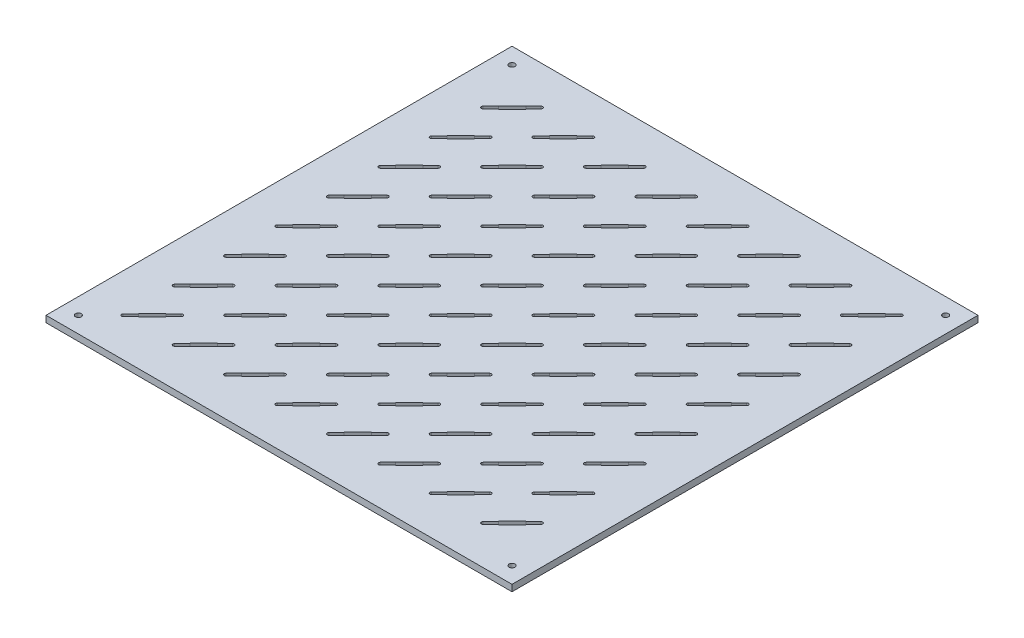
from build123d import *

# Parameters (mm, degrees)
SKETCH1_W           = 431.8
SKETCH1_H           = 431.8
BOSS_EXTRUDE1_DEPTH = 6
CUT_EXTRUDE1_DEPTH  = 4
SKETCH5_R           = 1.5875
CUT_EXTRUDE3_DEPTH  = 611.68689195
SKETCH6_R           = 2.65
CUT_EXTRUDE4_DEPTH  = 611.68689195


with BuildPart() as part:
    # Sketch1 → Boss-Extrude1 (new body)
    with BuildSketch(Plane(origin=(0, 0, 0), x_dir=(1, 0, 0), z_dir=(0, 1, 0))):
        with Locations((215.9, 215.9)):
            Rectangle(SKETCH1_W, SKETCH1_H)
    extrude(amount=BOSS_EXTRUDE1_DEPTH)

    # Sketch2 → Cut-Extrude1 (cut)
    with BuildSketch(Plane(origin=(0, 6, 0), x_dir=(1, 0, 0), z_dir=(0, 1, 0))):
        Polygon((41.725327811, 43.970391841), (34.654259999, 36.899324029), (36.899324029, 34.654259999), (43.970391841, 41.725327811), (44.262073388, 41.433646263), (56.98999545, 54.161568325), (56.698313902, 54.453249872), (63.769381714, 61.524317684), (61.524317684, 63.769381714), (54.453249872, 56.698313902), (54.161568325, 56.98999545), (41.433646263, 44.262073388), align=None)
        Polygon((56.98999545, 101.791568325), (56.698313902, 102.083249872), (63.769381714, 109.154317684), (61.524317684, 111.399381714), (54.453249872, 104.328313902), (54.161568325, 104.61999545), (41.433646263, 91.892073388), (41.725327811, 91.600391841), (34.654259999, 84.529324029), (36.899324029, 82.284259999), (43.970391841, 89.355327811), (44.262073388, 89.063646263), align=None)
        Polygon((56.98999545, 149.421568325), (56.698313902, 149.713249872), (63.769381714, 156.784317684), (61.524317684, 159.029381714), (54.453249872, 151.958313902), (54.161568325, 152.24999545), (41.433646263, 139.522073388), (41.725327811, 139.230391841), (34.654259999, 132.159324029), (36.899324029, 129.914259999), (43.970391841, 136.985327811), (44.262073388, 136.693646263), align=None)
        Polygon((56.98999545, 197.051568325), (56.698313902, 197.343249872), (63.769381714, 204.414317684), (61.524317684, 206.659381714), (54.453249872, 199.588313902), (54.161568325, 199.87999545), (41.433646263, 187.152073388), (41.725327811, 186.860391841), (34.654259999, 179.789324029), (36.899324029, 177.544259999), (43.970391841, 184.615327811), (44.262073388, 184.323646263), align=None)
        Polygon((56.98999545, 244.681568325), (56.698313902, 244.973249872), (63.769381714, 252.044317684), (61.524317684, 254.289381714), (54.453249872, 247.218313902), (54.161568325, 247.50999545), (41.433646263, 234.782073388), (41.725327811, 234.490391841), (34.654259999, 227.419324029), (36.899324029, 225.174259999), (43.970391841, 232.245327811), (44.262073388, 231.953646263), align=None)
        Polygon((56.98999545, 292.311568325), (56.698313902, 292.603249872), (63.769381714, 299.674317684), (61.524317684, 301.919381714), (54.453249872, 294.848313902), (54.161568325, 295.13999545), (41.433646263, 282.412073388), (41.725327811, 282.120391841), (34.654259999, 275.049324029), (36.899324029, 272.804259999), (43.970391841, 279.875327811), (44.262073388, 279.583646263), align=None)
        Polygon((56.98999545, 339.941568325), (56.698313902, 340.233249872), (63.769381714, 347.304317684), (61.524317684, 349.549381714), (54.453249872, 342.478313902), (54.161568325, 342.76999545), (41.433646263, 330.042073388), (41.725327811, 329.750391841), (34.654259999, 322.679324029), (36.899324029, 320.434259999), (43.970391841, 327.505327811), (44.262073388, 327.213646263), align=None)
        Polygon((56.98999545, 387.571568325), (56.698313902, 387.863249872), (63.769381714, 394.934317684), (61.524317684, 397.179381714), (54.453249872, 390.108313902), (54.161568325, 390.39999545), (41.433646263, 377.672073388), (41.725327811, 377.380391841), (34.654259999, 370.309324029), (36.899324029, 368.064259999), (43.970391841, 375.135327811), (44.262073388, 374.843646263), align=None)
        Polygon((104.619995449, 101.791568325), (104.328313902, 102.083249872), (111.399381714, 109.154317684), (109.154317684, 111.399381714), (102.083249872, 104.328313902), (101.791568325, 104.61999545), (89.063646263, 91.892073388), (89.355327811, 91.600391841), (82.284259999, 84.529324029), (84.529324029, 82.284259999), (91.600391841, 89.355327811), (91.892073388, 89.063646263), align=None)
        Polygon((104.619995449, 149.421568325), (104.328313902, 149.713249872), (111.399381714, 156.784317684), (109.154317684, 159.029381714), (102.083249872, 151.958313902), (101.791568325, 152.24999545), (89.063646263, 139.522073388), (89.355327811, 139.230391841), (82.284259999, 132.159324029), (84.529324029, 129.914259999), (91.600391841, 136.985327811), (91.892073388, 136.693646263), align=None)
        Polygon((104.619995449, 197.051568325), (104.328313902, 197.343249872), (111.399381714, 204.414317684), (109.154317684, 206.659381714), (102.083249872, 199.588313902), (101.791568325, 199.87999545), (89.063646263, 187.152073388), (89.355327811, 186.860391841), (82.284259999, 179.789324029), (84.529324029, 177.544259999), (91.600391841, 184.615327811), (91.892073388, 184.323646263), align=None)
        Polygon((104.619995449, 244.681568325), (104.328313902, 244.973249872), (111.399381714, 252.044317684), (109.154317684, 254.289381714), (102.083249872, 247.218313902), (101.791568325, 247.50999545), (89.063646263, 234.782073388), (89.355327811, 234.490391841), (82.284259999, 227.419324029), (84.529324029, 225.174259999), (91.600391841, 232.245327811), (91.892073388, 231.953646263), align=None)
        Polygon((104.619995449, 292.311568325), (104.328313902, 292.603249872), (111.399381714, 299.674317684), (109.154317684, 301.919381714), (102.083249872, 294.848313902), (101.791568325, 295.13999545), (89.063646263, 282.412073388), (89.355327811, 282.120391841), (82.284259999, 275.049324029), (84.529324029, 272.804259999), (91.600391841, 279.875327811), (91.892073388, 279.583646263), align=None)
        Polygon((104.619995449, 339.941568325), (104.328313902, 340.233249872), (111.399381714, 347.304317684), (109.154317684, 349.549381714), (102.083249872, 342.478313902), (101.791568325, 342.76999545), (89.063646263, 330.042073388), (89.355327811, 329.750391841), (82.284259999, 322.679324029), (84.529324029, 320.434259999), (91.600391841, 327.505327811), (91.892073388, 327.213646263), align=None)
        Polygon((104.619995449, 387.571568325), (104.328313902, 387.863249872), (111.399381714, 394.934317684), (109.154317684, 397.179381714), (102.083249872, 390.108313902), (101.791568325, 390.39999545), (89.063646263, 377.672073388), (89.355327811, 377.380391841), (82.284259999, 370.309324029), (84.529324029, 368.064259999), (91.600391841, 375.135327811), (91.892073388, 374.843646263), align=None)
        Polygon((152.249995449, 101.791568325), (151.958313902, 102.083249872), (159.029381714, 109.154317684), (156.784317684, 111.399381714), (149.713249872, 104.328313902), (149.421568325, 104.61999545), (136.693646263, 91.892073388), (136.985327811, 91.600391841), (129.914259999, 84.529324029), (132.159324029, 82.284259999), (139.230391841, 89.355327811), (139.522073388, 89.063646263), align=None)
        Polygon((152.249995449, 149.421568325), (151.958313902, 149.713249872), (159.029381714, 156.784317684), (156.784317684, 159.029381714), (149.713249872, 151.958313902), (149.421568325, 152.24999545), (136.693646263, 139.522073388), (136.985327811, 139.230391841), (129.914259999, 132.159324029), (132.159324029, 129.914259999), (139.230391841, 136.985327811), (139.522073388, 136.693646263), align=None)
        Polygon((152.249995449, 197.051568325), (151.958313902, 197.343249872), (159.029381714, 204.414317684), (156.784317684, 206.659381714), (149.713249872, 199.588313902), (149.421568325, 199.87999545), (136.693646263, 187.152073388), (136.985327811, 186.860391841), (129.914259999, 179.789324029), (132.159324029, 177.544259999), (139.230391841, 184.615327811), (139.522073388, 184.323646263), align=None)
        Polygon((152.249995449, 244.681568325), (151.958313902, 244.973249872), (159.029381714, 252.044317684), (156.784317684, 254.289381714), (149.713249872, 247.218313902), (149.421568325, 247.50999545), (136.693646263, 234.782073388), (136.985327811, 234.490391841), (129.914259999, 227.419324029), (132.159324029, 225.174259999), (139.230391841, 232.245327811), (139.522073388, 231.953646263), align=None)
        Polygon((152.249995449, 292.311568325), (151.958313902, 292.603249872), (159.029381714, 299.674317684), (156.784317684, 301.919381714), (149.713249872, 294.848313902), (149.421568325, 295.13999545), (136.693646263, 282.412073388), (136.985327811, 282.120391841), (129.914259999, 275.049324029), (132.159324029, 272.804259999), (139.230391841, 279.875327811), (139.522073388, 279.583646263), align=None)
        Polygon((152.249995449, 339.941568325), (151.958313902, 340.233249872), (159.029381714, 347.304317684), (156.784317684, 349.549381714), (149.713249872, 342.478313902), (149.421568325, 342.76999545), (136.693646263, 330.042073388), (136.985327811, 329.750391841), (129.914259999, 322.679324029), (132.159324029, 320.434259999), (139.230391841, 327.505327811), (139.522073388, 327.213646263), align=None)
        Polygon((152.249995449, 387.571568325), (151.958313902, 387.863249872), (159.029381714, 394.934317684), (156.784317684, 397.179381714), (149.713249872, 390.108313902), (149.421568325, 390.39999545), (136.693646263, 377.672073388), (136.985327811, 377.380391841), (129.914259999, 370.309324029), (132.159324029, 368.064259999), (139.230391841, 375.135327811), (139.522073388, 374.843646263), align=None)
        Polygon((199.879995449, 101.791568325), (199.588313902, 102.083249872), (206.659381714, 109.154317684), (204.414317684, 111.399381714), (197.343249872, 104.328313902), (197.051568325, 104.61999545), (184.323646263, 91.892073388), (184.615327811, 91.600391841), (177.544259999, 84.529324029), (179.789324029, 82.284259999), (186.860391841, 89.355327811), (187.152073388, 89.063646263), align=None)
        Polygon((199.879995449, 149.421568325), (199.588313902, 149.713249872), (206.659381714, 156.784317684), (204.414317684, 159.029381714), (197.343249872, 151.958313902), (197.051568325, 152.24999545), (184.323646263, 139.522073388), (184.615327811, 139.230391841), (177.544259999, 132.159324029), (179.789324029, 129.914259999), (186.860391841, 136.985327811), (187.152073388, 136.693646263), align=None)
        Polygon((199.879995449, 197.051568325), (199.588313902, 197.343249872), (206.659381714, 204.414317684), (204.414317684, 206.659381714), (197.343249872, 199.588313902), (197.051568325, 199.87999545), (184.323646263, 187.152073388), (184.615327811, 186.860391841), (177.544259999, 179.789324029), (179.789324029, 177.544259999), (186.860391841, 184.615327811), (187.152073388, 184.323646263), align=None)
        Polygon((199.879995449, 244.681568325), (199.588313902, 244.973249872), (206.659381714, 252.044317684), (204.414317684, 254.289381714), (197.343249872, 247.218313902), (197.051568325, 247.50999545), (184.323646263, 234.782073388), (184.615327811, 234.490391841), (177.544259999, 227.419324029), (179.789324029, 225.174259999), (186.860391841, 232.245327811), (187.152073388, 231.953646263), align=None)
        Polygon((199.879995449, 292.311568325), (199.588313902, 292.603249872), (206.659381714, 299.674317684), (204.414317684, 301.919381714), (197.343249872, 294.848313902), (197.051568325, 295.13999545), (184.323646263, 282.412073388), (184.615327811, 282.120391841), (177.544259999, 275.049324029), (179.789324029, 272.804259999), (186.860391841, 279.875327811), (187.152073388, 279.583646263), align=None)
        Polygon((199.879995449, 339.941568325), (199.588313902, 340.233249872), (206.659381714, 347.304317684), (204.414317684, 349.549381714), (197.343249872, 342.478313902), (197.051568325, 342.76999545), (184.323646263, 330.042073388), (184.615327811, 329.750391841), (177.544259999, 322.679324029), (179.789324029, 320.434259999), (186.860391841, 327.505327811), (187.152073388, 327.213646263), align=None)
        Polygon((199.879995449, 387.571568325), (199.588313902, 387.863249872), (206.659381714, 394.934317684), (204.414317684, 397.179381714), (197.343249872, 390.108313902), (197.051568325, 390.39999545), (184.323646263, 377.672073388), (184.615327811, 377.380391841), (177.544259999, 370.309324029), (179.789324029, 368.064259999), (186.860391841, 375.135327811), (187.152073388, 374.843646263), align=None)
        Polygon((247.509995449, 101.791568325), (247.218313902, 102.083249872), (254.289381714, 109.154317684), (252.044317684, 111.399381714), (244.973249872, 104.328313902), (244.681568325, 104.61999545), (231.953646263, 91.892073388), (232.245327811, 91.600391841), (225.174259999, 84.529324029), (227.419324029, 82.284259999), (234.490391841, 89.355327811), (234.782073388, 89.063646263), align=None)
        Polygon((247.509995449, 149.421568325), (247.218313902, 149.713249872), (254.289381714, 156.784317684), (252.044317684, 159.029381714), (244.973249872, 151.958313902), (244.681568325, 152.24999545), (231.953646263, 139.522073388), (232.245327811, 139.230391841), (225.174259999, 132.159324029), (227.419324029, 129.914259999), (234.490391841, 136.985327811), (234.782073388, 136.693646263), align=None)
        Polygon((247.509995449, 197.051568325), (247.218313902, 197.343249872), (254.289381714, 204.414317684), (252.044317684, 206.659381714), (244.973249872, 199.588313902), (244.681568325, 199.87999545), (231.953646263, 187.152073388), (232.245327811, 186.860391841), (225.174259999, 179.789324029), (227.419324029, 177.544259999), (234.490391841, 184.615327811), (234.782073388, 184.323646263), align=None)
        Polygon((247.509995449, 244.681568325), (247.218313902, 244.973249872), (254.289381714, 252.044317684), (252.044317684, 254.289381714), (244.973249872, 247.218313902), (244.681568325, 247.50999545), (231.953646263, 234.782073388), (232.245327811, 234.490391841), (225.174259999, 227.419324029), (227.419324029, 225.174259999), (234.490391841, 232.245327811), (234.782073388, 231.953646263), align=None)
        Polygon((247.509995449, 292.311568325), (247.218313902, 292.603249872), (254.289381714, 299.674317684), (252.044317684, 301.919381714), (244.973249872, 294.848313902), (244.681568325, 295.13999545), (231.953646263, 282.412073388), (232.245327811, 282.120391841), (225.174259999, 275.049324029), (227.419324029, 272.804259999), (234.490391841, 279.875327811), (234.782073388, 279.583646263), align=None)
        Polygon((247.509995449, 339.941568325), (247.218313902, 340.233249872), (254.289381714, 347.304317684), (252.044317684, 349.549381714), (244.973249872, 342.478313902), (244.681568325, 342.76999545), (231.953646263, 330.042073388), (232.245327811, 329.750391841), (225.174259999, 322.679324029), (227.419324029, 320.434259999), (234.490391841, 327.505327811), (234.782073388, 327.213646263), align=None)
        Polygon((247.509995449, 387.571568325), (247.218313902, 387.863249872), (254.289381714, 394.934317684), (252.044317684, 397.179381714), (244.973249872, 390.108313902), (244.681568325, 390.39999545), (231.953646263, 377.672073388), (232.245327811, 377.380391841), (225.174259999, 370.309324029), (227.419324029, 368.064259999), (234.490391841, 375.135327811), (234.782073388, 374.843646263), align=None)
        Polygon((295.139995449, 101.791568325), (294.848313902, 102.083249872), (301.919381714, 109.154317684), (299.674317684, 111.399381714), (292.603249872, 104.328313902), (292.311568325, 104.61999545), (279.583646263, 91.892073388), (279.875327811, 91.600391841), (272.804259999, 84.529324029), (275.049324029, 82.284259999), (282.120391841, 89.355327811), (282.412073388, 89.063646263), align=None)
        Polygon((295.139995449, 149.421568325), (294.848313902, 149.713249872), (301.919381714, 156.784317684), (299.674317684, 159.029381714), (292.603249872, 151.958313902), (292.311568325, 152.24999545), (279.583646263, 139.522073388), (279.875327811, 139.230391841), (272.804259999, 132.159324029), (275.049324029, 129.914259999), (282.120391841, 136.985327811), (282.412073388, 136.693646263), align=None)
        Polygon((295.139995449, 197.051568325), (294.848313902, 197.343249872), (301.919381714, 204.414317684), (299.674317684, 206.659381714), (292.603249872, 199.588313902), (292.311568325, 199.87999545), (279.583646263, 187.152073388), (279.875327811, 186.860391841), (272.804259999, 179.789324029), (275.049324029, 177.544259999), (282.120391841, 184.615327811), (282.412073388, 184.323646263), align=None)
        Polygon((295.139995449, 244.681568325), (294.848313902, 244.973249872), (301.919381714, 252.044317684), (299.674317684, 254.289381714), (292.603249872, 247.218313902), (292.311568325, 247.50999545), (279.583646263, 234.782073388), (279.875327811, 234.490391841), (272.804259999, 227.419324029), (275.049324029, 225.174259999), (282.120391841, 232.245327811), (282.412073388, 231.953646263), align=None)
        Polygon((295.139995449, 292.311568325), (294.848313902, 292.603249872), (301.919381714, 299.674317684), (299.674317684, 301.919381714), (292.603249872, 294.848313902), (292.311568325, 295.13999545), (279.583646263, 282.412073388), (279.875327811, 282.120391841), (272.804259999, 275.049324029), (275.049324029, 272.804259999), (282.120391841, 279.875327811), (282.412073388, 279.583646263), align=None)
        Polygon((295.139995449, 339.941568325), (294.848313902, 340.233249872), (301.919381714, 347.304317684), (299.674317684, 349.549381714), (292.603249872, 342.478313902), (292.311568325, 342.76999545), (279.583646263, 330.042073388), (279.875327811, 329.750391841), (272.804259999, 322.679324029), (275.049324029, 320.434259999), (282.120391841, 327.505327811), (282.412073388, 327.213646263), align=None)
        Polygon((295.139995449, 387.571568325), (294.848313902, 387.863249872), (301.919381714, 394.934317684), (299.674317684, 397.179381714), (292.603249872, 390.108313902), (292.311568325, 390.39999545), (279.583646263, 377.672073388), (279.875327811, 377.380391841), (272.804259999, 370.309324029), (275.049324029, 368.064259999), (282.120391841, 375.135327811), (282.412073388, 374.843646263), align=None)
        Polygon((342.769995449, 101.791568325), (342.478313902, 102.083249872), (349.549381714, 109.154317684), (347.304317684, 111.399381714), (340.233249872, 104.328313902), (339.941568325, 104.61999545), (327.213646263, 91.892073388), (327.505327811, 91.600391841), (320.434259999, 84.529324029), (322.679324029, 82.284259999), (329.750391841, 89.355327811), (330.042073388, 89.063646263), align=None)
        Polygon((342.769995449, 149.421568325), (342.478313902, 149.713249872), (349.549381714, 156.784317684), (347.304317684, 159.029381714), (340.233249872, 151.958313902), (339.941568325, 152.24999545), (327.213646263, 139.522073388), (327.505327811, 139.230391841), (320.434259999, 132.159324029), (322.679324029, 129.914259999), (329.750391841, 136.985327811), (330.042073388, 136.693646263), align=None)
        Polygon((342.769995449, 197.051568325), (342.478313902, 197.343249872), (349.549381714, 204.414317684), (347.304317684, 206.659381714), (340.233249872, 199.588313902), (339.941568325, 199.87999545), (327.213646263, 187.152073388), (327.505327811, 186.860391841), (320.434259999, 179.789324029), (322.679324029, 177.544259999), (329.750391841, 184.615327811), (330.042073388, 184.323646263), align=None)
        Polygon((342.769995449, 244.681568325), (342.478313902, 244.973249872), (349.549381714, 252.044317684), (347.304317684, 254.289381714), (340.233249872, 247.218313902), (339.941568325, 247.50999545), (327.213646263, 234.782073388), (327.505327811, 234.490391841), (320.434259999, 227.419324029), (322.679324029, 225.174259999), (329.750391841, 232.245327811), (330.042073388, 231.953646263), align=None)
        Polygon((342.769995449, 292.311568325), (342.478313902, 292.603249872), (349.549381714, 299.674317684), (347.304317684, 301.919381714), (340.233249872, 294.848313902), (339.941568325, 295.13999545), (327.213646263, 282.412073388), (327.505327811, 282.120391841), (320.434259999, 275.049324029), (322.679324029, 272.804259999), (329.750391841, 279.875327811), (330.042073388, 279.583646263), align=None)
        Polygon((342.769995449, 339.941568325), (342.478313902, 340.233249872), (349.549381714, 347.304317684), (347.304317684, 349.549381714), (340.233249872, 342.478313902), (339.941568325, 342.76999545), (327.213646263, 330.042073388), (327.505327811, 329.750391841), (320.434259999, 322.679324029), (322.679324029, 320.434259999), (329.750391841, 327.505327811), (330.042073388, 327.213646263), align=None)
        Polygon((342.769995449, 387.571568325), (342.478313902, 387.863249872), (349.549381714, 394.934317684), (347.304317684, 397.179381714), (340.233249872, 390.108313902), (339.941568325, 390.39999545), (327.213646263, 377.672073388), (327.505327811, 377.380391841), (320.434259999, 370.309324029), (322.679324029, 368.064259999), (329.750391841, 375.135327811), (330.042073388, 374.843646263), align=None)
        Polygon((390.399995449, 101.791568325), (390.108313902, 102.083249872), (397.179381714, 109.154317684), (394.934317684, 111.399381714), (387.863249872, 104.328313902), (387.571568325, 104.61999545), (374.843646263, 91.892073388), (375.13532781, 91.600391841), (368.064259999, 84.529324029), (370.309324029, 82.284259999), (377.380391841, 89.355327811), (377.672073388, 89.063646263), align=None)
        Polygon((390.399995449, 149.421568325), (390.108313902, 149.713249872), (397.179381714, 156.784317684), (394.934317684, 159.029381714), (387.863249872, 151.958313902), (387.571568325, 152.24999545), (374.843646263, 139.522073388), (375.13532781, 139.230391841), (368.064259999, 132.159324029), (370.309324029, 129.914259999), (377.380391841, 136.985327811), (377.672073388, 136.693646263), align=None)
        Polygon((390.399995449, 197.051568325), (390.108313902, 197.343249872), (397.179381714, 204.414317684), (394.934317684, 206.659381714), (387.863249872, 199.588313902), (387.571568325, 199.87999545), (374.843646263, 187.152073388), (375.13532781, 186.860391841), (368.064259999, 179.789324029), (370.309324029, 177.544259999), (377.380391841, 184.615327811), (377.672073388, 184.323646263), align=None)
        Polygon((390.399995449, 244.681568325), (390.108313902, 244.973249872), (397.179381714, 252.044317684), (394.934317684, 254.289381714), (387.863249872, 247.218313902), (387.571568325, 247.50999545), (374.843646263, 234.782073388), (375.13532781, 234.490391841), (368.064259999, 227.419324029), (370.309324029, 225.174259999), (377.380391841, 232.245327811), (377.672073388, 231.953646263), align=None)
        Polygon((390.399995449, 292.311568325), (390.108313902, 292.603249872), (397.179381714, 299.674317684), (394.934317684, 301.919381714), (387.863249872, 294.848313902), (387.571568325, 295.13999545), (374.843646263, 282.412073388), (375.13532781, 282.120391841), (368.064259999, 275.049324029), (370.309324029, 272.804259999), (377.380391841, 279.875327811), (377.672073388, 279.583646263), align=None)
        Polygon((390.399995449, 339.941568325), (390.108313902, 340.233249872), (397.179381714, 347.304317684), (394.934317684, 349.549381714), (387.863249872, 342.478313902), (387.571568325, 342.76999545), (374.843646263, 330.042073388), (375.13532781, 329.750391841), (368.064259999, 322.679324029), (370.309324029, 320.434259999), (377.380391841, 327.505327811), (377.672073388, 327.213646263), align=None)
        Polygon((390.399995449, 387.571568325), (390.108313902, 387.863249872), (397.179381714, 394.934317684), (394.934317684, 397.179381714), (387.863249872, 390.108313902), (387.571568325, 390.39999545), (374.843646263, 377.672073388), (375.13532781, 377.380391841), (368.064259999, 370.309324029), (370.309324029, 368.064259999), (377.380391841, 375.135327811), (377.672073388, 374.843646263), align=None)
        Polygon((104.619995449, 54.161568325), (104.328313902, 54.453249872), (111.399381714, 61.524317684), (109.154317684, 63.769381714), (102.083249872, 56.698313902), (101.791568325, 56.98999545), (89.063646263, 44.262073388), (89.355327811, 43.970391841), (82.284259999, 36.899324029), (84.529324029, 34.654259999), (91.600391841, 41.725327811), (91.892073388, 41.433646263), align=None)
        Polygon((152.249995449, 54.161568325), (151.958313902, 54.453249872), (159.029381714, 61.524317684), (156.784317684, 63.769381714), (149.713249872, 56.698313902), (149.421568325, 56.98999545), (136.693646263, 44.262073388), (136.985327811, 43.970391841), (129.914259999, 36.899324029), (132.159324029, 34.654259999), (139.230391841, 41.725327811), (139.522073388, 41.433646263), align=None)
        Polygon((199.879995449, 54.161568325), (199.588313902, 54.453249872), (206.659381714, 61.524317684), (204.414317684, 63.769381714), (197.343249872, 56.698313902), (197.051568325, 56.98999545), (184.323646263, 44.262073388), (184.615327811, 43.970391841), (177.544259999, 36.899324029), (179.789324029, 34.654259999), (186.860391841, 41.725327811), (187.152073388, 41.433646263), align=None)
        Polygon((247.509995449, 54.161568325), (247.218313902, 54.453249872), (254.289381714, 61.524317684), (252.044317684, 63.769381714), (244.973249872, 56.698313902), (244.681568325, 56.98999545), (231.953646263, 44.262073388), (232.245327811, 43.970391841), (225.174259999, 36.899324029), (227.419324029, 34.654259999), (234.490391841, 41.725327811), (234.782073388, 41.433646263), align=None)
        Polygon((295.139995449, 54.161568325), (294.848313902, 54.453249872), (301.919381714, 61.524317684), (299.674317684, 63.769381714), (292.603249872, 56.698313902), (292.311568325, 56.98999545), (279.583646263, 44.262073388), (279.875327811, 43.970391841), (272.804259999, 36.899324029), (275.049324029, 34.654259999), (282.120391841, 41.725327811), (282.412073388, 41.433646263), align=None)
        Polygon((342.769995449, 54.161568325), (342.478313902, 54.453249872), (349.549381714, 61.524317684), (347.304317684, 63.769381714), (340.233249872, 56.698313902), (339.941568325, 56.98999545), (327.213646263, 44.262073388), (327.505327811, 43.970391841), (320.434259999, 36.899324029), (322.679324029, 34.654259999), (329.750391841, 41.725327811), (330.042073388, 41.433646263), align=None)
        Polygon((390.399995449, 54.161568325), (390.108313902, 54.453249872), (397.179381714, 61.524317684), (394.934317684, 63.769381714), (387.863249872, 56.698313902), (387.571568325, 56.98999545), (374.843646263, 44.262073388), (375.13532781, 43.970391841), (368.064259999, 36.899324029), (370.309324029, 34.654259999), (377.380391841, 41.725327811), (377.672073388, 41.433646263), align=None)
    extrude(amount=-CUT_EXTRUDE1_DEPTH, mode=Mode.SUBTRACT)

    # Sketch5 → Cut-Extrude3 (cut, through all)
    with BuildSketch(Plane(origin=(0, 6, 0), x_dir=(1, 0, 0), z_dir=(0, 1, 0))):
        with Locations((35.776792014, 35.776792014)):
            Circle(SKETCH5_R)
        with Locations((62.646849699, 62.646849699)):
            Circle(SKETCH5_R)
        with Locations((35.776792014, 83.406792014)):
            Circle(SKETCH5_R)
        with Locations((62.646849699, 110.276849699)):
            Circle(SKETCH5_R)
        with Locations((35.776792014, 131.036792014)):
            Circle(SKETCH5_R)
        with Locations((62.646849699, 157.906849699)):
            Circle(SKETCH5_R)
        with Locations((35.776792014, 178.666792014)):
            Circle(SKETCH5_R)
        with Locations((62.646849699, 205.536849699)):
            Circle(SKETCH5_R)
        with Locations((35.776792014, 226.296792014)):
            Circle(SKETCH5_R)
        with Locations((62.646849699, 253.166849699)):
            Circle(SKETCH5_R)
        with Locations((35.776792014, 273.926792014)):
            Circle(SKETCH5_R)
        with Locations((62.646849699, 300.796849699)):
            Circle(SKETCH5_R)
        with Locations((35.776792014, 321.556792014)):
            Circle(SKETCH5_R)
        with Locations((62.646849699, 348.426849699)):
            Circle(SKETCH5_R)
        with Locations((35.776792014, 369.186792014)):
            Circle(SKETCH5_R)
        with Locations((62.646849699, 396.056849699)):
            Circle(SKETCH5_R)
        with Locations((83.406792014, 83.406792014)):
            Circle(SKETCH5_R)
        with Locations((110.276849699, 110.276849699)):
            Circle(SKETCH5_R)
        with Locations((83.406792014, 131.036792014)):
            Circle(SKETCH5_R)
        with Locations((110.276849699, 157.906849699)):
            Circle(SKETCH5_R)
        with Locations((83.406792014, 178.666792014)):
            Circle(SKETCH5_R)
        with Locations((110.276849699, 205.536849699)):
            Circle(SKETCH5_R)
        with Locations((83.406792014, 226.296792014)):
            Circle(SKETCH5_R)
        with Locations((110.276849699, 253.166849699)):
            Circle(SKETCH5_R)
        with Locations((83.406792014, 273.926792014)):
            Circle(SKETCH5_R)
        with Locations((110.276849699, 300.796849699)):
            Circle(SKETCH5_R)
        with Locations((83.406792014, 321.556792014)):
            Circle(SKETCH5_R)
        with Locations((110.276849699, 348.426849699)):
            Circle(SKETCH5_R)
        with Locations((83.406792014, 369.186792014)):
            Circle(SKETCH5_R)
        with Locations((110.276849699, 396.056849699)):
            Circle(SKETCH5_R)
        with Locations((131.036792014, 83.406792014)):
            Circle(SKETCH5_R)
        with Locations((157.906849699, 110.276849699)):
            Circle(SKETCH5_R)
        with Locations((131.036792014, 131.036792014)):
            Circle(SKETCH5_R)
        with Locations((157.906849699, 157.906849699)):
            Circle(SKETCH5_R)
        with Locations((131.036792014, 178.666792014)):
            Circle(SKETCH5_R)
        with Locations((157.906849699, 205.536849699)):
            Circle(SKETCH5_R)
        with Locations((131.036792014, 226.296792014)):
            Circle(SKETCH5_R)
        with Locations((157.906849699, 253.166849699)):
            Circle(SKETCH5_R)
        with Locations((131.036792014, 273.926792014)):
            Circle(SKETCH5_R)
        with Locations((157.906849699, 300.796849699)):
            Circle(SKETCH5_R)
        with Locations((131.036792014, 321.556792014)):
            Circle(SKETCH5_R)
        with Locations((157.906849699, 348.426849699)):
            Circle(SKETCH5_R)
        with Locations((131.036792014, 369.186792014)):
            Circle(SKETCH5_R)
        with Locations((157.906849699, 396.056849699)):
            Circle(SKETCH5_R)
        with Locations((178.666792014, 83.406792014)):
            Circle(SKETCH5_R)
        with Locations((205.536849699, 110.276849699)):
            Circle(SKETCH5_R)
        with Locations((178.666792014, 131.036792014)):
            Circle(SKETCH5_R)
        with Locations((205.536849699, 157.906849699)):
            Circle(SKETCH5_R)
        with Locations((178.666792014, 178.666792014)):
            Circle(SKETCH5_R)
        with Locations((205.536849699, 205.536849699)):
            Circle(SKETCH5_R)
        with Locations((178.666792014, 226.296792014)):
            Circle(SKETCH5_R)
        with Locations((205.536849699, 253.166849699)):
            Circle(SKETCH5_R)
        with Locations((178.666792014, 273.926792014)):
            Circle(SKETCH5_R)
        with Locations((205.536849699, 300.796849699)):
            Circle(SKETCH5_R)
        with Locations((178.666792014, 321.556792014)):
            Circle(SKETCH5_R)
        with Locations((205.536849699, 348.426849699)):
            Circle(SKETCH5_R)
        with Locations((178.666792014, 369.186792014)):
            Circle(SKETCH5_R)
        with Locations((205.536849699, 396.056849699)):
            Circle(SKETCH5_R)
        with Locations((226.296792014, 83.406792014)):
            Circle(SKETCH5_R)
        with Locations((253.166849699, 110.276849699)):
            Circle(SKETCH5_R)
        with Locations((226.296792014, 131.036792014)):
            Circle(SKETCH5_R)
        with Locations((253.166849699, 157.906849699)):
            Circle(SKETCH5_R)
        with Locations((226.296792014, 178.666792014)):
            Circle(SKETCH5_R)
        with Locations((253.166849699, 205.536849699)):
            Circle(SKETCH5_R)
        with Locations((226.296792014, 226.296792014)):
            Circle(SKETCH5_R)
        with Locations((253.166849699, 253.166849699)):
            Circle(SKETCH5_R)
        with Locations((226.296792014, 273.926792014)):
            Circle(SKETCH5_R)
        with Locations((253.166849699, 300.796849699)):
            Circle(SKETCH5_R)
        with Locations((226.296792014, 321.556792014)):
            Circle(SKETCH5_R)
        with Locations((253.166849699, 348.426849699)):
            Circle(SKETCH5_R)
        with Locations((226.296792014, 369.186792014)):
            Circle(SKETCH5_R)
        with Locations((253.166849699, 396.056849699)):
            Circle(SKETCH5_R)
        with Locations((273.926792014, 83.406792014)):
            Circle(SKETCH5_R)
        with Locations((300.796849699, 110.276849699)):
            Circle(SKETCH5_R)
        with Locations((273.926792014, 131.036792014)):
            Circle(SKETCH5_R)
        with Locations((300.796849699, 157.906849699)):
            Circle(SKETCH5_R)
        with Locations((273.926792014, 178.666792014)):
            Circle(SKETCH5_R)
        with Locations((300.796849699, 205.536849699)):
            Circle(SKETCH5_R)
        with Locations((273.926792014, 226.296792014)):
            Circle(SKETCH5_R)
        with Locations((300.796849699, 253.166849699)):
            Circle(SKETCH5_R)
        with Locations((273.926792014, 273.926792014)):
            Circle(SKETCH5_R)
        with Locations((300.796849699, 300.796849699)):
            Circle(SKETCH5_R)
        with Locations((273.926792014, 321.556792014)):
            Circle(SKETCH5_R)
        with Locations((300.796849699, 348.426849699)):
            Circle(SKETCH5_R)
        with Locations((273.926792014, 369.186792014)):
            Circle(SKETCH5_R)
        with Locations((300.796849699, 396.056849699)):
            Circle(SKETCH5_R)
        with Locations((321.556792014, 83.406792014)):
            Circle(SKETCH5_R)
        with Locations((348.426849699, 110.276849699)):
            Circle(SKETCH5_R)
        with Locations((321.556792014, 131.036792014)):
            Circle(SKETCH5_R)
        with Locations((348.426849699, 157.906849699)):
            Circle(SKETCH5_R)
        with Locations((321.556792014, 178.666792014)):
            Circle(SKETCH5_R)
        with Locations((348.426849699, 205.536849699)):
            Circle(SKETCH5_R)
        with Locations((321.556792014, 226.296792014)):
            Circle(SKETCH5_R)
        with Locations((348.426849699, 253.166849699)):
            Circle(SKETCH5_R)
        with Locations((321.556792014, 273.926792014)):
            Circle(SKETCH5_R)
        with Locations((348.426849699, 300.796849699)):
            Circle(SKETCH5_R)
        with Locations((321.556792014, 321.556792014)):
            Circle(SKETCH5_R)
        with Locations((348.426849699, 348.426849699)):
            Circle(SKETCH5_R)
        with Locations((321.556792014, 369.186792014)):
            Circle(SKETCH5_R)
        with Locations((348.426849699, 396.056849699)):
            Circle(SKETCH5_R)
        with Locations((369.186792014, 83.406792014)):
            Circle(SKETCH5_R)
        with Locations((396.056849699, 110.276849699)):
            Circle(SKETCH5_R)
        with Locations((369.186792014, 131.036792014)):
            Circle(SKETCH5_R)
        with Locations((396.056849699, 157.906849699)):
            Circle(SKETCH5_R)
        with Locations((369.186792014, 178.666792014)):
            Circle(SKETCH5_R)
        with Locations((396.056849699, 205.536849699)):
            Circle(SKETCH5_R)
        with Locations((369.186792014, 226.296792014)):
            Circle(SKETCH5_R)
        with Locations((396.056849699, 253.166849699)):
            Circle(SKETCH5_R)
        with Locations((369.186792014, 273.926792014)):
            Circle(SKETCH5_R)
        with Locations((396.056849699, 300.796849699)):
            Circle(SKETCH5_R)
        with Locations((369.186792014, 321.556792014)):
            Circle(SKETCH5_R)
        with Locations((396.056849699, 348.426849699)):
            Circle(SKETCH5_R)
        with Locations((369.186792014, 369.186792014)):
            Circle(SKETCH5_R)
        with Locations((396.056849699, 396.056849699)):
            Circle(SKETCH5_R)
        with Locations((83.406792014, 35.776792014)):
            Circle(SKETCH5_R)
        with Locations((110.276849699, 62.646849699)):
            Circle(SKETCH5_R)
        with Locations((131.036792014, 35.776792014)):
            Circle(SKETCH5_R)
        with Locations((157.906849699, 62.646849699)):
            Circle(SKETCH5_R)
        with Locations((178.666792014, 35.776792014)):
            Circle(SKETCH5_R)
        with Locations((205.536849699, 62.646849699)):
            Circle(SKETCH5_R)
        with Locations((226.296792014, 35.776792014)):
            Circle(SKETCH5_R)
        with Locations((253.166849699, 62.646849699)):
            Circle(SKETCH5_R)
        with Locations((273.926792014, 35.776792014)):
            Circle(SKETCH5_R)
        with Locations((300.796849699, 62.646849699)):
            Circle(SKETCH5_R)
        with Locations((321.556792014, 35.776792014)):
            Circle(SKETCH5_R)
        with Locations((348.426849699, 62.646849699)):
            Circle(SKETCH5_R)
        with Locations((369.186792014, 35.776792014)):
            Circle(SKETCH5_R)
        with Locations((396.056849699, 62.646849699)):
            Circle(SKETCH5_R)
    extrude(amount=-CUT_EXTRUDE3_DEPTH, mode=Mode.SUBTRACT)

    # Sketch6 → Cut-Extrude4 (cut, through all)
    with BuildSketch(Plane(origin=(0, 6, 0), x_dir=(1, 0, 0), z_dir=(0, 1, 0))):
        with Locations((15, 416.8)):
            Circle(SKETCH6_R)
        with Locations((416.8, 416.8)):
            Circle(SKETCH6_R)
        with Locations((416.8, 15)):
            Circle(SKETCH6_R)
        with Locations((15, 15)):
            Circle(SKETCH6_R)
    extrude(amount=-CUT_EXTRUDE4_DEPTH, mode=Mode.SUBTRACT)


solid = part.part
